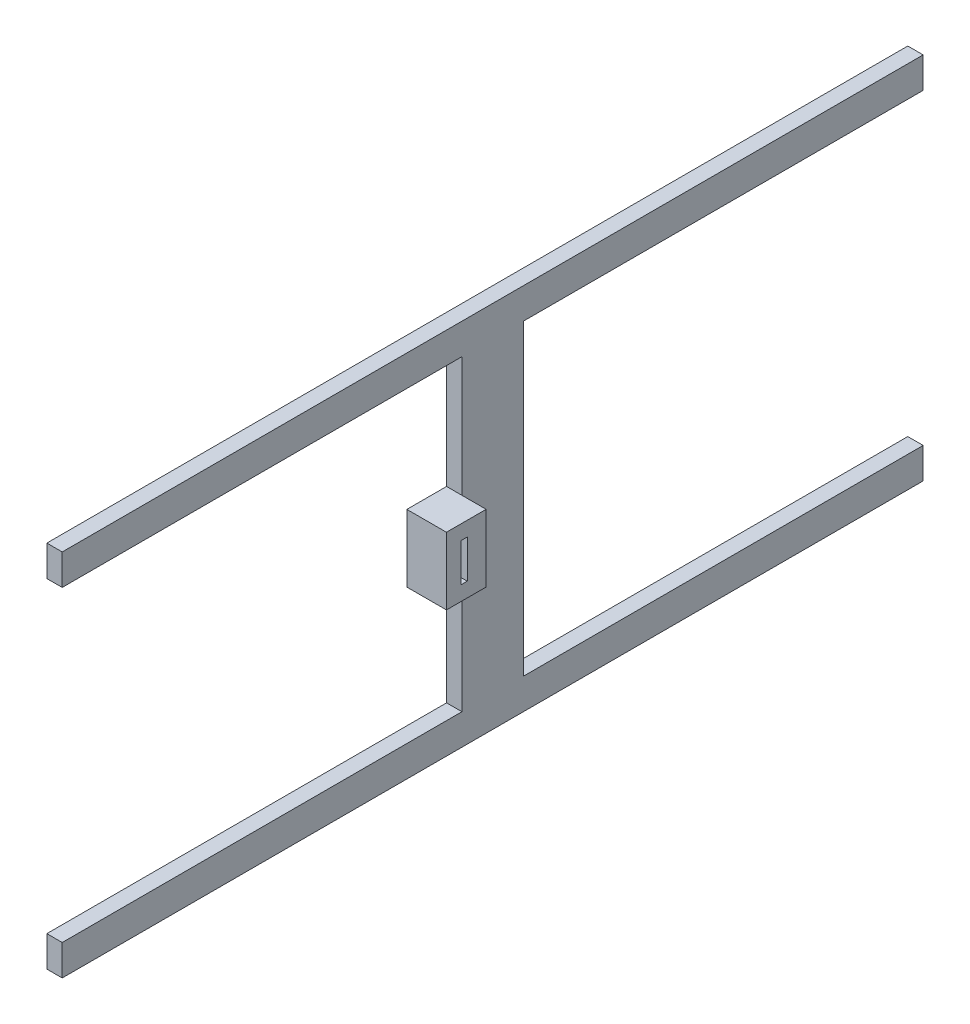
from build123d import *

# Parameters (mm, degrees)
BOSS_EXTRUDE1_DEPTH = 3.175
BOSS_EXTRUDE2_DEPTH = 5
SKETCH4_W           = 8.2
SKETCH4_H           = 13.9
SKETCH4_W_2         = 1.3
SKETCH4_H_2         = 7.9
BOSS_EXTRUDE3_DEPTH = 3.175


with BuildPart() as part:
    # Sketch1 → Boss-Extrude1 (new body)
    with BuildSketch(Plane(origin=(0, 0, 0), x_dir=(0, 0, -1), z_dir=(1, 0, 0))):
        Polygon((19.732226513, 31.75), (19.732226513, -31.75), (-62.817773487, -31.75), (-62.817773487, -38.1), (114.982226513, -38.1), (114.982226513, -31.75), (32.432226513, -31.75), (32.432226513, 31.75), (114.982226513, 31.75), (114.982226513, 38.1), (-62.817773487, 38.1), (-62.817773487, 31.75), align=None)
    extrude(amount=BOSS_EXTRUDE1_DEPTH)

    # Sketch2 → Boss-Extrude2 (add)
    with BuildSketch(Plane.ZY):
        Polygon((-19.732226513, 6.95), (-19.732226513, 3.95), (-14.532226513, 3.95), (-14.532226513, -3.95), (-19.732226513, -3.95), (-19.732226513, -6.95), (-11.532226513, -6.95), (-11.532226513, 6.95), align=None)
    extrude(amount=-BOSS_EXTRUDE2_DEPTH)

    # Sketch4 → Boss-Extrude3 (add)
    with BuildSketch(Plane(origin=(5, 0, 0), x_dir=(0, 0, -1), z_dir=(1, 0, 0))):
        with Locations((15.632226513, 0)):
            Rectangle(SKETCH4_W, SKETCH4_H)
        with Locations((15.182226513, 0)):
            Rectangle(SKETCH4_W_2, SKETCH4_H_2, mode=Mode.SUBTRACT)
    extrude(amount=BOSS_EXTRUDE3_DEPTH)


solid = part.part
